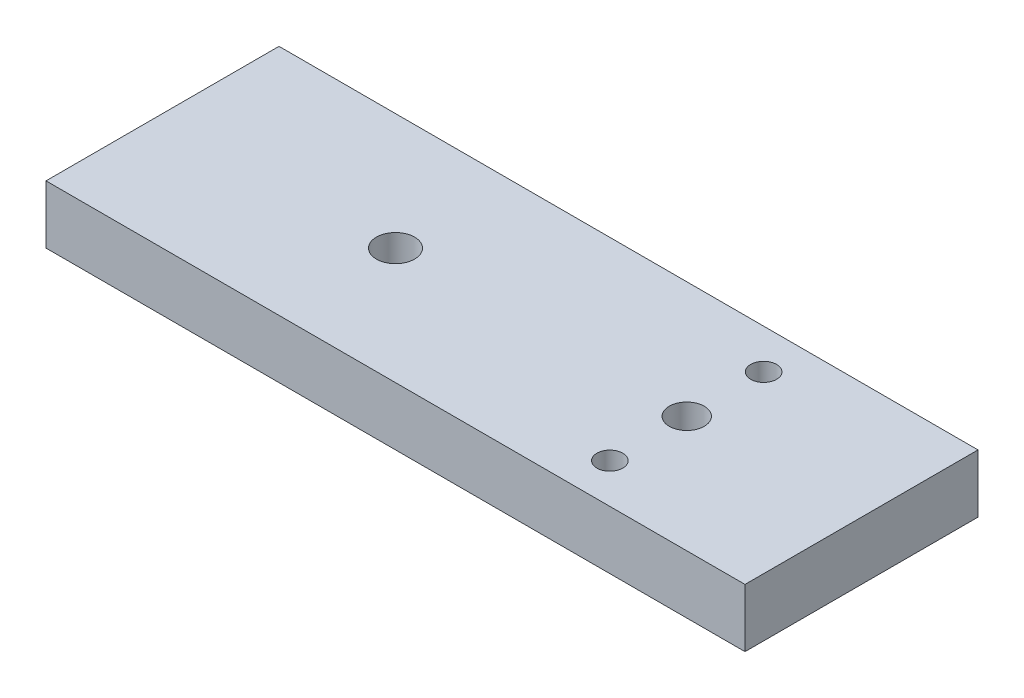
from build123d import *

# Parameters (mm, degrees)
BOSS_EXTRUDE1_DEPTH = 6.35
CUT_EXTRUDE1_DEPTH  = 6.35


with BuildPart() as part:
    # Sketch2 → Boss-Extrude1 (new body)
    with BuildSketch(Plane(origin=(0, 0, 0), x_dir=(1, 0, 0), z_dir=(0, 1, 0))):
        Polygon((0, 25.4), (0, 12.7), (0, 0), (76.2, 0), (76.2, 25.4), align=None)
        with BuildLine():
            ThreePointArc((58.56224, 4.318), (56.151395519, 3.319395519), (57.15, 5.73024))
            ThreePointArc((57.15, 5.73024), (58.148604481, 5.316604481), (58.56224, 4.318))
        make_face(mode=Mode.SUBTRACT)
        with BuildLine():
            ThreePointArc((57.15, 10.795), (55.802961582, 11.352961582), (55.245, 12.7))
            ThreePointArc((55.245, 12.7), (55.802961582, 14.047038418), (57.15, 14.605))
            ThreePointArc((57.15, 14.605), (58.497038418, 14.047038418), (59.055, 12.7))
            ThreePointArc((59.055, 12.7), (58.497038418, 11.352961582), (57.15, 10.795))
        make_face(mode=Mode.SUBTRACT)
        with BuildLine():
            ThreePointArc((58.56224, 21.082), (58.148604481, 20.083395519), (57.15, 19.66976))
            ThreePointArc((57.15, 19.66976), (56.151395519, 22.080604481), (58.56224, 21.082))
        make_face(mode=Mode.SUBTRACT)
    extrude(amount=BOSS_EXTRUDE1_DEPTH)

    # Sketch3 → Cut-Extrude1 (cut)
    with BuildSketch(Plane(origin=(0, 6.35, 0), x_dir=(1, 0, 0), z_dir=(0, 1, 0))):
        with BuildLine():
            ThreePointArc((23.3172, 12.7), (25.4, 10.6172), (27.4828, 12.7))
            ThreePointArc((27.4828, 12.7), (25.4, 14.7828), (23.3172, 12.7))
        make_face()
    extrude(amount=-CUT_EXTRUDE1_DEPTH, mode=Mode.SUBTRACT)


solid = part.part
